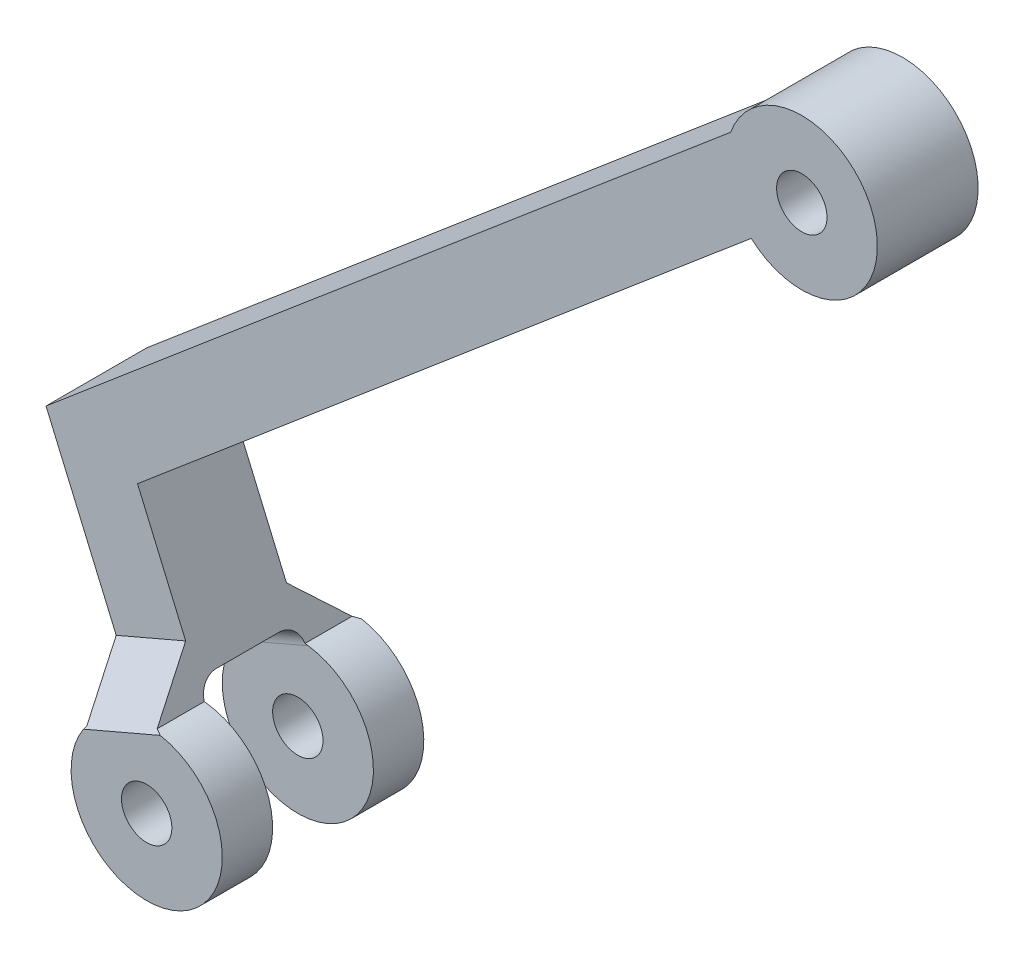
from build123d import *

# Parameters (mm, degrees)
SKETCH7_R               = 2.9999999999999982
SKETCH7_R_2             = 1.0000000000000018
SKETCH7_R_3             = 3.0000000000000018
SKETCH7_R_4             = 0.9999999999999983
BOSS_EXTRUDE1_DEPTH     = 2
SKETCH9_R               = 0.9999999999999983
BOSS_EXTRUDE2_DEPTH     = 4
CUT_EXTRUDE3_DEPTH      = 68.5610601855979
CUT_EXTRUDE3_DEPTH_BACK = 68.5610601855979
CHAMFER1_SIZE           = 2
FILLET10_R              = 0.75


with BuildPart() as part:
    # Sketch7 → Boss-Extrude1 (new, symmetric)
    # profile 1 of 3: a face of its own
    with BuildSketch(Plane.XY):
        with BuildLine():
            Line((11.893863235859584, 53.137939029439345), (15.445357626885196, 44.86830254465274))
            ThreePointArc((15.445357626885198, 44.86830254465274), (16.642699652600193, 45.857903547949306), (18.174468795559314, 46.11601469638566))
            Line((18.174468795559314, 46.11601469638567), (15.526434240422798, 52.28194958437761))
            Line((15.526434240422798, 52.28194958437761), (39.886948210676515, 72.89692053805315))
            ThreePointArc((39.88694821067651, 72.89692053805315), (38.98584570958542, 74.39162614577609), (39.06921198001558, 76.13495073866909))
            Line((39.06921198001558, 76.13495073866909), (11.893863235859584, 53.137939029439345))
        make_face()
    # profile 2 of 3: a face of its own
    with BuildSketch(Plane.XY):
        with Locations((17.890076901850104, 43.12952490889392)):
            Circle(SKETCH7_R)
        with Locations((17.890076901850104, 43.12952490889392)):
            Circle(SKETCH7_R_2, mode=Mode.SUBTRACT)
    # profile 3 of 3: a face of its own
    with BuildSketch(Plane.XY):
        with Locations((41.8945256681437, 75.12618785093188)):
            Circle(SKETCH7_R_3)
        with Locations((41.8945256681437, 75.12618785093188)):
            Circle(SKETCH7_R_4, mode=Mode.SUBTRACT)
    extrude(amount=BOSS_EXTRUDE1_DEPTH, both=True)

    # Sketch9 → Boss-Extrude2 (add, symmetric)
    with BuildSketch(Plane.XY):
        with BuildLine():
            Line((17.43729995500307, 47.832508562943936), (18.174468795559275, 46.11601469638567))
            ThreePointArc((18.174468795559275, 46.11601469638567), (19.137454151100034, 40.40114626983855), (15.4453576268852, 44.86830254465274))
            Line((15.4453576268852, 44.86830254465274), (14.680754460074215, 46.64867709926875))
            Line((14.680754460074215, 46.64867709926875), (17.43729995500307, 47.832508562943936))
        make_face()
        with Locations((17.890076901850104, 43.12952490889392)):
            Circle(SKETCH9_R, mode=Mode.SUBTRACT)
    extrude(amount=BOSS_EXTRUDE2_DEPTH, both=True)

    # Sketch10 → Cut-Extrude3 (cut, two sides: drawn at the far end of the back side and taken through both)
    with BuildSketch(Plane(origin=(32.06546623724915, 13.770898357710635, 0), x_dir=(0, 0, -1), z_dir=(0.9188484983096216, 0.39461048789173536, 0)).offset(-CUT_EXTRUDE3_DEPTH_BACK)):
        Polygon((1.9999999999999996, 27.385841036947262), (-1.9999999999999991, 27.385841036947262), (-1.9999999999999996, 35.88584103694727), (2.0000000000000004, 35.88584103694727), align=None)
    extrude(amount=CUT_EXTRUDE3_DEPTH + CUT_EXTRUDE3_DEPTH_BACK, mode=Mode.SUBTRACT)

    # Chamfer1
    chamfer1_edges = [part.edges().sort_by_distance(p)[0] for p in [
        (16.05902720753864, 47.24059283110634, -4),
        (16.05902720753864, 47.24059283110634, 4),
    ]]
    chamfer(chamfer1_edges, length=CHAMFER1_SIZE - 0.0001)  # a hair under: the kernel refuses the full size

    # Fillet10
    fillet10_edges = [part.edges().sort_by_distance(p)[0] for p in [
        (16.526264249789705, 46.15263377324982, -2.0000000000000004),
        (16.526264249789676, 46.15263377324982, 1.9999999999999996),
    ]]
    fillet(fillet10_edges, radius=FILLET10_R)


solid = part.part
